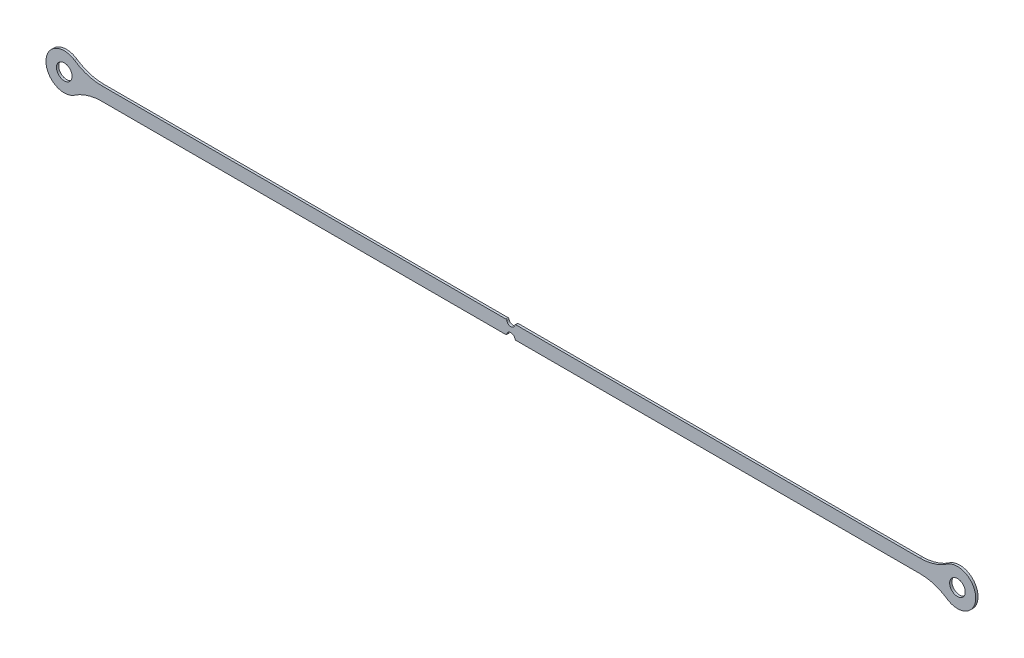
from build123d import *

# Parameters (mm, degrees)
SKETCH1_R           = 4.05
BOSS_EXTRUDE1_DEPTH = 1.2


with BuildPart() as part:
    # Sketch1 → Boss-Extrude1 (new body)
    with BuildSketch(Plane.XY):
        with BuildLine():
            ThreePointArc((2.111383352, 3.094339623), (0, 1.35), (-2.111383352, 3.094339623))
            ThreePointArc((-2.111383352, 3.094339623), (-2.283945369, 3.385467127), (-2.602402736, 3.5))
            Line((-2.602402736, 3.5), (-212.557777905, 3.5))
            ThreePointArc((-212.557777905, 3.5), (-219.929875713, 4.611672852), (-226.64634464, 7.847826087))
            ThreePointArc((-226.64634464, 7.847826087), (-241.5, 0), (-226.64634464, -7.847826087))
            ThreePointArc((-226.64634464, -7.847826087), (-219.929875713, -4.611672852), (-212.557777905, -3.5))
            Line((-212.557777905, -3.5), (-2.602402736, -3.5))
            ThreePointArc((-2.602402736, -3.5), (-2.283945369, -3.385467127), (-2.111383352, -3.094339623))
            ThreePointArc((-2.111383352, -3.094339623), (0, -1.35), (2.111383352, -3.094339623))
            ThreePointArc((2.111383352, -3.094339623), (2.283945369, -3.385467127), (2.602402736, -3.5))
            Line((2.602402736, -3.5), (212.557777905, -3.5))
            ThreePointArc((212.557777905, -3.5), (219.929875713, -4.611672852), (226.64634464, -7.847826087))
            ThreePointArc((226.64634464, -7.847826087), (241.5, 0), (226.64634464, 7.847826087))
            ThreePointArc((226.64634464, 7.847826087), (219.929875713, 4.611672852), (212.557777905, 3.5))
            Line((212.557777905, 3.5), (2.602402736, 3.5))
            ThreePointArc((2.602402736, 3.5), (2.283945369, 3.385467127), (2.111383352, 3.094339623))
        make_face()
        with Locations((232, 0)):
            Circle(SKETCH1_R, mode=Mode.SUBTRACT)
        with Locations((-232, 0)):
            Circle(SKETCH1_R, mode=Mode.SUBTRACT)
    extrude(amount=BOSS_EXTRUDE1_DEPTH)


solid = part.part
